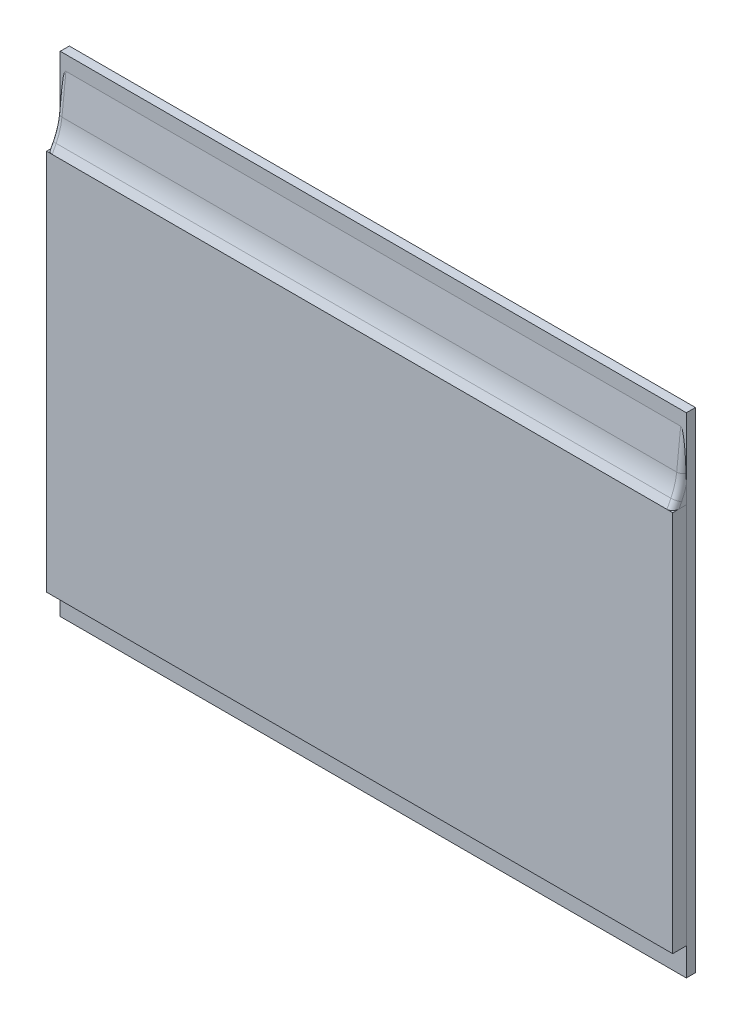
from build123d import *

# Parameters (mm, degrees)
SKETCH1_W           = 55
SKETCH1_H           = 43
GLASSBASE_DEPTH     = 0.8
SKETCH3_W           = 51
SKETCH3_H           = 31
SKETCH3_W_2         = 47.99
SKETCH3_H_2         = 27.83
BOSS_EXTRUDE3_DEPTH = 0.05
SKETCH4_W           = 47.99
SKETCH4_H           = 27.83
BOSS_EXTRUDE4_DEPTH = 0.05
SKETCH5_W           = 51
SKETCH5_H           = 31
BOSS_EXTRUDE5_DEPTH = 0.05
SKETCH6_W           = 55
SKETCH6_H           = 33.55
BOSS_EXTRUDE6_DEPTH = 1.2
BOSS_EXTRUDE7_DEPTH = 55
FILLET1_R           = 0.5
FILLET2_R           = 0.5


with BuildPart() as part:
    # Sketch1 → GlassBase (new body)
    with BuildSketch(Plane.XY):
        Rectangle(SKETCH1_W, SKETCH1_H)
    extrude(amount=GLASSBASE_DEPTH)


with BuildPart() as body_2:
    # Sketch3 → Boss-Extrude3 (new body)
    with BuildSketch(Plane.XY.offset(0.8)):
        with Locations((0, -2.3)):
            Rectangle(SKETCH3_W, SKETCH3_H)
        with Locations((0, -2.3)):
            Rectangle(SKETCH3_W_2, SKETCH3_H_2, mode=Mode.SUBTRACT)
    extrude(amount=BOSS_EXTRUDE3_DEPTH)


with BuildPart() as body_3:
    # Sketch4 → Boss-Extrude4 (new body)
    with BuildSketch(Plane.XY.offset(0.8)):
        with Locations((0, -2.3)):
            Rectangle(SKETCH4_W, SKETCH4_H)
    extrude(amount=BOSS_EXTRUDE4_DEPTH)


with BuildPart() as body_4:
    # Sketch5 → Boss-Extrude5 (new body)
    with BuildSketch(Plane.XY.offset(0.85)):
        with Locations((0, -2.3)):
            Rectangle(SKETCH5_W, SKETCH5_H)
        with BuildLine():
            Line((-24.5, -17.3), (24.5, -17.3))
            ThreePointArc((24.5, -17.3), (24.853553391, -17.153553391), (25, -16.8))
            Line((25, -16.8), (25, 12.2))
            ThreePointArc((25, 12.2), (24.853553391, 12.553553391), (24.5, 12.7))
            Line((24.5, 12.7), (-24.5, 12.7))
            ThreePointArc((-24.5, 12.7), (-24.853553391, 12.553553391), (-25, 12.2))
            Line((-25, 12.2), (-25, -16.8))
            ThreePointArc((-25, -16.8), (-24.853553391, -17.153553391), (-24.5, -17.3))
        make_face(mode=Mode.SUBTRACT)
    extrude(amount=BOSS_EXTRUDE5_DEPTH)


with BuildPart() as body_5:
    # Sketch6 → Boss-Extrude6 (new body)
    with BuildSketch(Plane.XY.offset(0.8)):
        with Locations((0, -2.275)):
            Rectangle(SKETCH6_W, SKETCH6_H)
    extrude(amount=BOSS_EXTRUDE6_DEPTH)


with BuildPart() as body_6:
    # Sketch8 → Boss-Extrude7 (new body)
    with BuildSketch(Plane(origin=(-27.5, 14.5, 0.8), x_dir=(0, 0, 1), z_dir=(-1, 0, 0))):
        with BuildLine():
            Line((1.2, 0), (0.85856266, 0.674949192))
            ThreePointArc((0.85856266, 0.674949192), (0.523785891, 1.519615538), (0.347392821, 2.410919194))
            Line((0.347392821, 2.410919194), (0, 5.726486174))
            Line((0, 5.726486174), (0, 0))
            Line((0, 0), (1.2, 0))
        make_face()
    extrude(amount=-BOSS_EXTRUDE7_DEPTH)

    # Fillet1
    # the kernel refuses this fillet: 0.5 mm, written as the material it takes off along each edge
    with BuildSketch(Plane(origin=(-27.5, 16.910919194, 1.147392821), x_dir=(1, 0, 0), z_dir=(0, 0.994555748839717, -0.10420586571719334))) as fillet1_piece_1:
        with BuildLine():
            CenterArc((FILLET1_R, FILLET1_R), FILLET1_R, 180, 90)
            Line((0, FILLET1_R), (0, 0))
            Line((0, 0), (FILLET1_R, 0))
        make_face()
    extrude(amount=4.58371657, mode=Mode.SUBTRACT)
    with BuildSketch(Plane(origin=(-27.5, 17.431948523, 6.120171565), x_dir=(0, -0.45139986612381766, -0.8923217810091826), z_dir=(0, -0.8923217810091826, 0.45139986612381766))) as fillet1_piece_2:
        with BuildLine():
            CenterArc((5 + FILLET1_R, FILLET1_R), FILLET1_R, 180, 90)
            Line((5 + FILLET1_R, 0), (5, 0))
            Line((5, 0), (5, FILLET1_R))
        make_face()
    revolve(axis=Axis((-27.5, 17.431948523, 6.120171565), (1, 0, 0)), revolution_arc=20.852118409, mode=Mode.SUBTRACT)
    with BuildSketch(Plane(origin=(-27.5, 13.384597774, 2.564249833), x_dir=(1, 0, 0), z_dir=(0, 0.8923217810091835, -0.4513998661238159))) as fillet1_piece_3:
        with BuildLine():
            CenterArc((FILLET1_R, FILLET1_R), FILLET1_R, 180, 90)
            Line((0, FILLET1_R), (0, 0))
            Line((0, 0), (FILLET1_R, 0))
        make_face()
    extrude(amount=2.006396635, mode=Mode.SUBTRACT)

    # Fillet2
    # the kernel refuses this fillet: 0.5 mm, written as the material it takes off along each edge
    with BuildSketch(Plane(origin=(27.5, 17.431948523, 6.120171565), x_dir=(0, -0.45139986612381766, -0.8923217810091826), z_dir=(0, -0.8923217810091826, 0.45139986612381766))) as fillet2_piece_1:
        with BuildLine():
            CenterArc((5 + FILLET2_R, -FILLET2_R), FILLET2_R, 90, 90)
            Line((5 + FILLET2_R, 0), (5, 0))
            Line((5, 0), (5, -FILLET2_R))
        make_face()
    revolve(axis=Axis((27.5, 17.431948523, 6.120171565), (1, 0, 0)), revolution_arc=20.852118409, mode=Mode.SUBTRACT)
    with BuildSketch(Plane(origin=(27.5, 16.910919194, 1.147392821), x_dir=(0, -0.10420586571719336, -0.9945557488397171), z_dir=(0, 0.994555748839717, -0.10420586571719334))) as fillet2_piece_2:
        with BuildLine():
            CenterArc((FILLET2_R, FILLET2_R), FILLET2_R, 180, 90)
            Line((0, FILLET2_R), (0, 0))
            Line((0, 0), (FILLET2_R, 0))
        make_face()
    extrude(amount=4.58371657, mode=Mode.SUBTRACT)
    with BuildSketch(Plane(origin=(27.5, 13.384597774, 2.564249833), x_dir=(-1, 0, 0), z_dir=(0, 0.8923217810091835, -0.4513998661238159))) as fillet2_piece_3:
        with BuildLine():
            CenterArc((FILLET2_R, -FILLET2_R), FILLET2_R, 90, 90)
            Line((0, -FILLET2_R), (0, 0))
            Line((0, 0), (FILLET2_R, 0))
        make_face()
    extrude(amount=2.006396635, mode=Mode.SUBTRACT)


solid = Compound([part.part, body_2.part, body_3.part, body_4.part, body_5.part, body_6.part])
